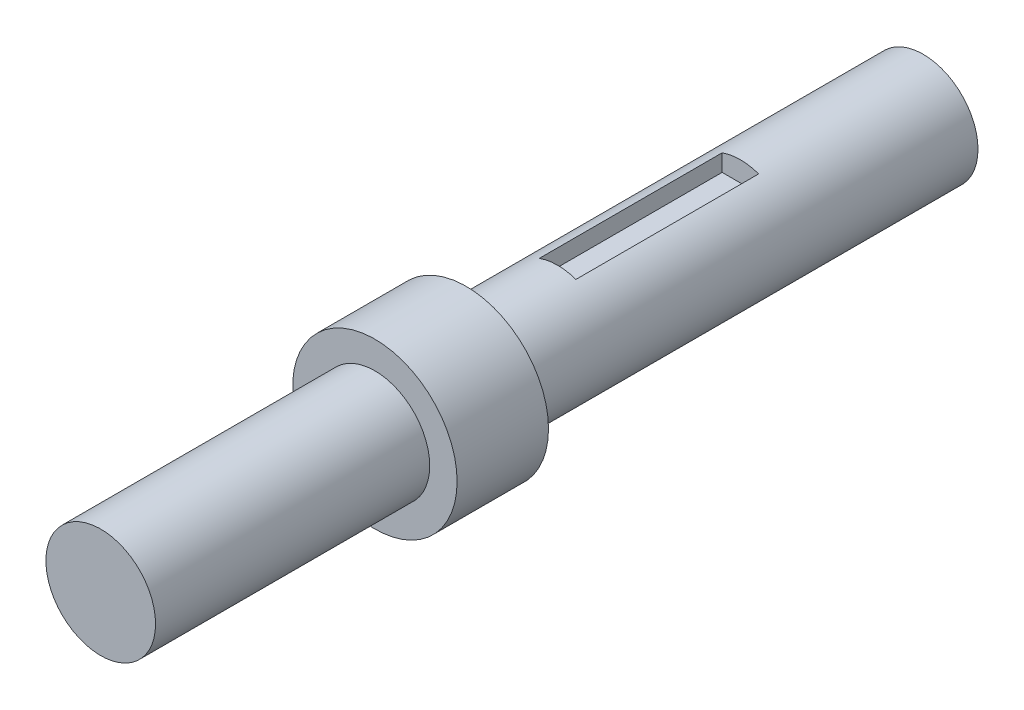
from build123d import *

# Parameters (mm, degrees)
SKETCH2_R           = 6
BOSS_EXTRUDE1_DEPTH = 50
SKETCH3_R           = 9
BOSS_EXTRUDE2_DEPTH = 10
SKETCH4_R           = 6
BOSS_EXTRUDE3_DEPTH = 30
SKETCH6_W           = 4
SKETCH6_H           = 20
CUT_EXTRUDE1_DEPTH  = 2.2


with BuildPart() as part:
    # Sketch2 → Boss-Extrude1 (new body)
    with BuildSketch(Plane.XY):
        Circle(SKETCH2_R)
    extrude(amount=BOSS_EXTRUDE1_DEPTH)

    # Sketch3 → Boss-Extrude2 (add)
    with BuildSketch(Plane.XY.offset(50)):
        Circle(SKETCH3_R)
    extrude(amount=BOSS_EXTRUDE2_DEPTH)

    # Sketch4 → Boss-Extrude3 (add)
    with BuildSketch(Plane.XY.offset(60)):
        Circle(SKETCH4_R)
    extrude(amount=BOSS_EXTRUDE3_DEPTH)

    # Sketch6 → Cut-Extrude1 (cut)
    with BuildSketch(Plane(origin=(0, 6, 0), x_dir=(1, 0, 0), z_dir=(0, 1, 0))):
        with Locations((0, -30)):
            Rectangle(SKETCH6_W, SKETCH6_H)
    extrude(amount=-CUT_EXTRUDE1_DEPTH, mode=Mode.SUBTRACT)


solid = part.part
